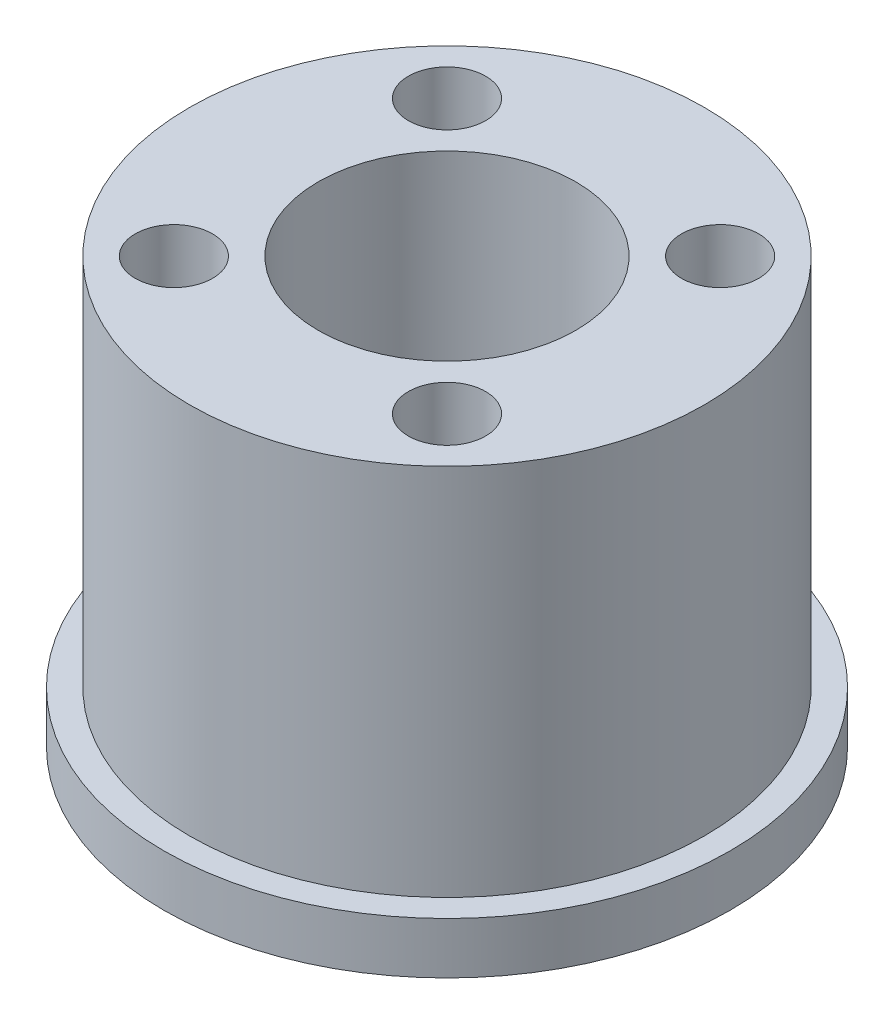
from build123d import *

# Parameters (mm, degrees)
SKETCH_1_W                = 11
SKETCH_1_H                = 2
SKETCH_2_R                = 10
EXTRUDE_1_DEPTH           = 14.5
HOLE_WIZARD_3_0_3_1_D     = 3
HOLE_WIZARD_3_0_3_1_DEPTH = 6
HOLE_WIZARD_10_0_10_1_D   = 10


with BuildPart() as part:
    # 草图1 → 旋转1 (revolve)
    with BuildSketch(Plane.XY):
        with Locations((5.5, 1)):
            Rectangle(SKETCH_1_W, SKETCH_1_H)
    revolve(axis=Axis((0, 2, 0), (0, -1, 0)))

    # 草图2 → 凸台-拉伸1 (add)
    with BuildSketch(Plane(origin=(0, 2, 0), x_dir=(-1, 0, 0), z_dir=(0, 1, 0))):
        Circle(SKETCH_2_R)
    extrude(amount=EXTRUDE_1_DEPTH)

    # Ø3.0 (3) 直径孔1
    with Locations(Plane(origin=(0, 16.5, 0), x_dir=(1, 0, 0), z_dir=(0, 1, 0))):
        with Locations((5.303300859, 5.303300859), (5.303300859, -5.303300859), (-5.303300859, -5.303300859), (-5.303300859, 5.303300859)):
            Hole(HOLE_WIZARD_3_0_3_1_D / 2, depth=HOLE_WIZARD_3_0_3_1_DEPTH)

    # Ø10.0 (10) 直径孔1 (through all)
    with Locations(Plane(origin=(0, 0, 0), x_dir=(-1, 0, 0), z_dir=(0, -1, 0))):
        with Locations((0, 0)):
            Hole(HOLE_WIZARD_10_0_10_1_D / 2)


solid = part.part
